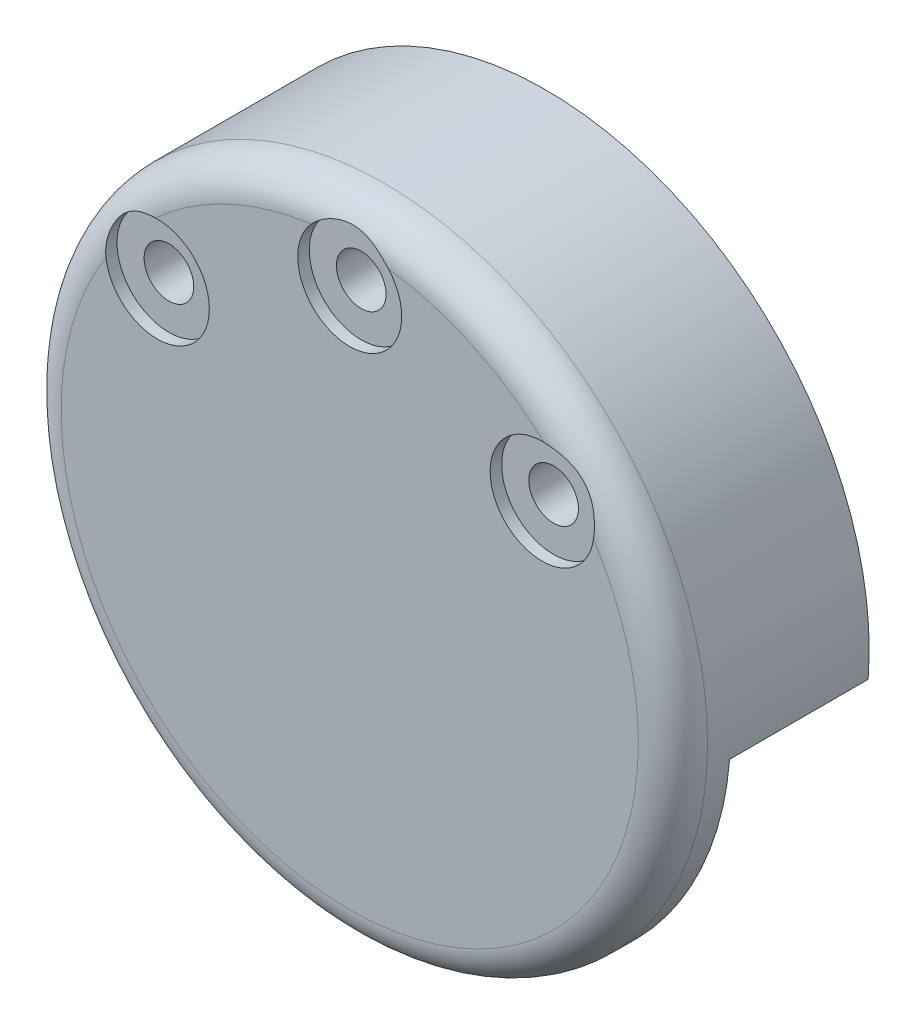
from build123d import *

# Parameters (mm, degrees)
SKETCH_1_R           = 28
EXTRUDE_1_DEPTH      = 15
CUT_EXTRUDE_START    = -22
CUT_EXTRUDE_1_DEPTH  = 22
EXTRUDE_2_DEPTH      = 2
EXTRUDE_2_DEPTH_BACK = 3
SKETCH_3_R           = 28
CUT_EXTRUDE_2_DEPTH  = 1
SKETCH_5_R           = 4.5
CUT_EXTRUDE_3_DEPTH  = 1
SKETCH_7_R           = 2.15
CUT_EXTRUDE_4_DEPTH  = 18
SKETCH_9_R           = 4.5
CUT_EXTRUDE_6_DEPTH  = 1
FILLET_5_R           = 3


with BuildPart() as part:
    # 草图1 → 凸台-拉伸1 (new body)
    with BuildSketch(Plane.XY):
        Circle(SKETCH_1_R)
    extrude(amount=EXTRUDE_1_DEPTH)

    # 草图2 → 切除-拉伸1 (cut)
    with BuildSketch(Plane.XY.offset(15).offset(CUT_EXTRUDE_START)):
        with BuildLine():
            Line((14.996539752, -0.000319471), (14.996539752, -2.262315411))
            Line((14.996539752, -2.262315411), (27.908456227, -2.262315411))
            ThreePointArc((27.908456227, -2.262315411), (-4.220435571, -27.680099776), (-27.314529778, 6.157634529))
            Line((-27.314529778, 6.157634529), (-13.674053592, 6.157634529))
            ThreePointArc((-13.674053592, 6.157634529), (3.149181128, 14.66215751), (14.996539752, -0.000319471))
        make_face()
    extrude(amount=CUT_EXTRUDE_1_DEPTH, mode=Mode.SUBTRACT)

    # 草图3 → 凸台-拉伸2 (add, two sides: drawn at the far end of the back side and taken through both)
    with BuildSketch(Plane.XY.offset(15).offset(-EXTRUDE_2_DEPTH_BACK)):
        with Locations(Location((0, 0, 0), (0, 0, 167.295928936))):
            Circle(SKETCH_3_R)
    extrude(amount=EXTRUDE_2_DEPTH + EXTRUDE_2_DEPTH_BACK)

    # 草图4 → 切除-拉伸2 (cut)
    with BuildSketch(Plane(origin=(0, 0, 12), x_dir=(-1, 0, 0), z_dir=(0, 0, -1))):
        with BuildLine():
            Line((26.535533906, 3.535533906), (27.775888825, 3.535533906))
            ThreePointArc((27.775888825, 3.535533906), (28, 0), (27.775888825, -3.535533906))
            Line((27.775888825, -3.535533906), (26.535533906, -3.535533906))
            ThreePointArc((26.535533906, -3.535533906), (18, 0), (26.535533906, 3.535533906))
        make_face()
    extrude(amount=-CUT_EXTRUDE_2_DEPTH, mode=Mode.SUBTRACT)

    # 草图5 → 切除-拉伸3 (cut)
    with BuildSketch(Plane(origin=(0, 0, 13), x_dir=(-1, 0, 0), z_dir=(0, 0, -1))):
        with Locations((23, 0)):
            Circle(SKETCH_5_R)
    extrude(amount=-CUT_EXTRUDE_3_DEPTH, mode=Mode.SUBTRACT)

    # 草图7 → 切除-拉伸4 (cut)
    with BuildSketch(Plane.XY):
        with Locations(Location((16.661466638, 13.980630511, 0), (0, 0, 180))):
            Circle(SKETCH_7_R)
        with Locations((-16.661466638, 13.980630511)):
            Circle(SKETCH_7_R)
        with Locations((0, 21.75)):
            Circle(SKETCH_7_R)
    extrude(amount=CUT_EXTRUDE_4_DEPTH, mode=Mode.SUBTRACT)

    # 草图9 → 切除-拉伸6 (cut)
    with BuildSketch(Plane.XY.offset(17)):
        with Locations((0, 21.75)):
            Circle(SKETCH_9_R)
        with Locations((16.661466638, 13.980630511)):
            Circle(SKETCH_9_R)
        with Locations((-16.661466638, 13.980630511)):
            Circle(SKETCH_9_R)
    extrude(amount=-CUT_EXTRUDE_6_DEPTH, mode=Mode.SUBTRACT)

    # 圆角5
    # the kernel refuses this fillet: 3 mm, written as the material it takes off along each edge
    with BuildSketch(Plane(origin=(14.996539752, -2.262315411, -7.462186675), x_dir=(1, 0, 0), z_dir=(0, 0, 1))) as fillet_5_piece_1:
        with BuildLine():
            CenterArc((2.98487467, 3), FILLET_5_R, 182.349232636, 87.650767364)
            Line((-0.012603956, 2.877028929), (-0.312351819, 2.864731822))
            ThreePointArc((-0.312351819, 2.864731822), (-0.3, 2.262002331), (-0.3, 0))
            Line((-0.3, 0), (0, -0.3))
            Line((0, -0.3), (2.98487467, -0.3))
            Line((2.98487467, -0.3), (2.98487467, 0))
        make_face()
    extrude(amount=19.462186675, mode=Mode.SUBTRACT)
    with BuildSketch(Plane(origin=(0, 0, 17), x_dir=(-0.9755189206474555, 0.21991551891311267, 0), z_dir=(0.21991551891311267, 0.9755189206474555, 0))) as fillet_5_piece_2:
        with BuildLine():
            CenterArc((28 - FILLET_5_R, -FILLET_5_R), FILLET_5_R, 0, 90)
            Line((28 - FILLET_5_R, 0), (28, 0))
            Line((28, 0), (28, -FILLET_5_R))
        make_face()
    revolve(axis=Axis((0, 0, 17), (0, 0, 1)), mode=Mode.SUBTRACT)


solid = part.part
